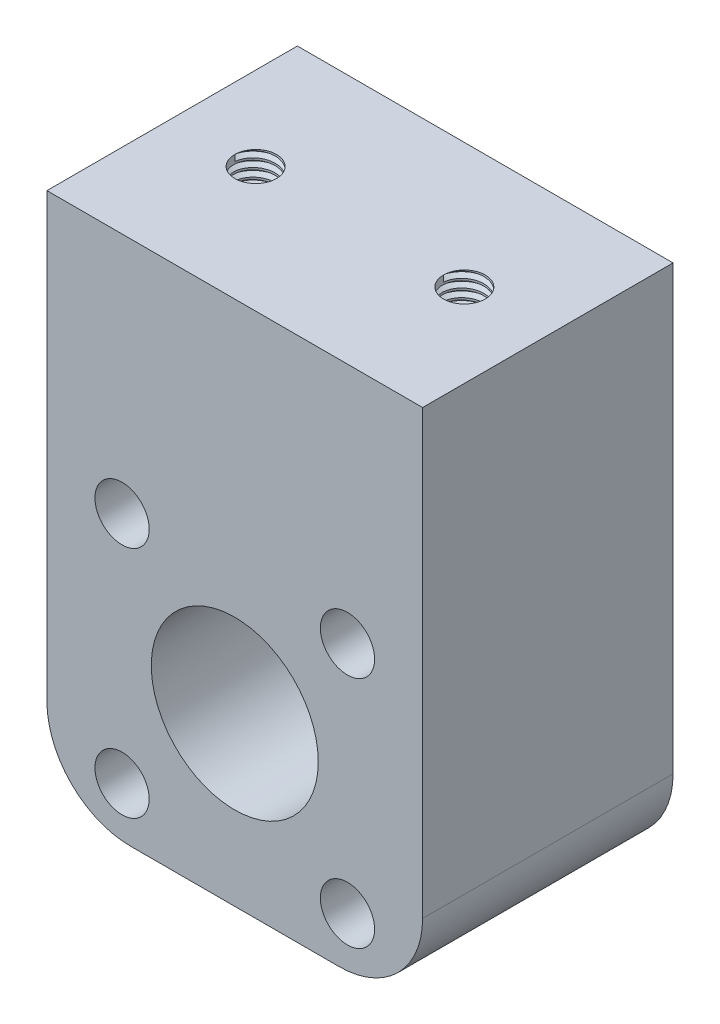
from build123d import *
from build123d.topology import SkipClean

# Parameters (mm, degrees)
SKETCH1_W           = 45
SKETCH1_H           = 63
BOSS_EXTRUDE1_DEPTH = 30
SKETCH2_R           = 10
CUT_EXTRUDE1_DEPTH  = 49.974483152
SKETCH3_R           = 3.25
CUT_EXTRUDE2_DEPTH  = 49.974483152
FILLET1_R           = 10
SKETCH4_R           = 2.5
CUT_EXTRUDE3_DEPTH  = 10
THREAD1_PITCH       = 1
THREAD2_PITCH       = 1


with BuildPart() as part:
    # Sketch1 → Boss-Extrude1 (new body)
    with BuildSketch(Plane.XY):
        Rectangle(SKETCH1_W, SKETCH1_H)
    extrude(amount=BOSS_EXTRUDE1_DEPTH)

    # Sketch2 → Cut-Extrude1 (cut, through all)
    with BuildSketch(Plane.XY.offset(30)):
        with Locations((0, -11.5)):
            Circle(SKETCH2_R)
    extrude(amount=-CUT_EXTRUDE1_DEPTH, mode=Mode.SUBTRACT)

    # Sketch3 → Cut-Extrude2 (cut, through all)
    with BuildSketch(Plane.XY.offset(30)):
        with Locations((-13.5, -25.5)):
            Circle(SKETCH3_R)
        with Locations((13.5, -25.5)):
            Circle(SKETCH3_R)
        with Locations((13.5, 2.5)):
            Circle(SKETCH3_R)
        with Locations((-13.5, 2.5)):
            Circle(SKETCH3_R)
    extrude(amount=-CUT_EXTRUDE2_DEPTH, mode=Mode.SUBTRACT)

    # Fillet1
    fillet1_edges = [part.edges().sort_by_distance(p)[0] for p in [
        (22.5, -31.5, 15),
        (-22.5, -31.5, 15),
    ]]
    fillet(fillet1_edges, radius=FILLET1_R)

    # Sketch4 → Cut-Extrude3 (cut)
    with BuildSketch(Plane(origin=(0, 31.5, 0), x_dir=(1, 0, 0), z_dir=(0, 1, 0))):
        with Locations(Location((-12.5, -15, 0), (0, 0, 270))):
            Circle(SKETCH4_R)
        with Locations(Location((12.5, -15, 0), (0, 0, 270))):
            Circle(SKETCH4_R)
    extrude(amount=-CUT_EXTRUDE3_DEPTH, mode=Mode.SUBTRACT)

    # Thread1: the profile of Thread Profile1 profile screwed along a right-hand helix of 10 turns, 8 arcs to a turn; built about Z, then put on its axis
    with SkipClean():  # the faces are left unmerged after this step: merging them gives an invalid solid
        thread1_z = Axis((0, 0, 0), (0, 0, 1))
        thread1_corners = [(2.4997, 0, -0.000173205), (3.041265875, 0, 0.312499999), (3.041265875, 0, 0.437499999), (2.4997, 0, 0.750173202)]
        with BuildLine(mode=Mode.PRIVATE) as thread1_profile:
            Line(thread1_corners[0], thread1_corners[1])
            Line(thread1_corners[1], thread1_corners[2])
            Line(thread1_corners[2], thread1_corners[3])
            Line(thread1_corners[3], thread1_corners[0])
        thread1_cap = Face(thread1_profile.wire())
        thread1_turn_angles = [0, 22.5, 45, 67.5, 90, 112.5, 135, 157.5, 180, 202.5, 225, 247.5, 270, 292.5, 315, 337.5, 360]
        thread1_turn_weights = [1, 0.9238795325112867, 1, 0.9238795325112867, 1, 0.9238795325112867, 1, 0.9238795325112867, 1, 0.9238795325112867, 1, 0.9238795325112867, 1, 0.9238795325112867, 1, 0.9238795325112867, 1]
        thread1_turn_rails = [Edge.make_bspline([Vector(p[0], p[1], 0).rotate(thread1_z, thread1_turn_angles[k]) / thread1_turn_weights[k] + Vector(0, 0, p[2] + THREAD1_PITCH * thread1_turn_angles[k] / 360) for k in range(17)], [0, 0, 0, 1, 1, 2, 2, 3, 3, 4, 4, 5, 5, 6, 6, 7, 7, 8, 8, 8], 2, thread1_turn_weights) for p in thread1_corners]
        thread1_turn_sides = [Face.make_surface_from_curves(thread1_turn_rails[p[0]], thread1_turn_rails[p[1]]) for p in [(0, 1), (1, 2), (2, 3), (3, 0)]]
        thread1 = Plane(origin=(12.5, 31.5, 15), x_dir=(-1, 0, 0), z_dir=(0, -1, 0)) * Solid(Shell([*[p.moved(Location((0, 0, THREAD1_PITCH * i))) for i in range(10) for p in thread1_turn_sides], thread1_cap, thread1_cap.rotate(thread1_z, 3600).moved(Location((0, 0, THREAD1_PITCH * 3600 / 360)))]))
        add(thread1, mode=Mode.SUBTRACT)

    # Thread2: the profile of Thread Profile2 profile screwed along a right-hand helix of 10 turns, 8 arcs to a turn; built about Z, then put on its axis
    with SkipClean():  # the faces are left unmerged after this step: merging them gives an invalid solid
        thread2_z = Axis((0, 0, 0), (0, 0, 1))
        thread2_corners = [(2.4997, 0, -0.000173205), (3.041265875, 0, 0.312499999), (3.041265875, 0, 0.437499999), (2.4997, 0, 0.750173202)]
        with BuildLine(mode=Mode.PRIVATE) as thread2_profile:
            Line(thread2_corners[0], thread2_corners[1])
            Line(thread2_corners[1], thread2_corners[2])
            Line(thread2_corners[2], thread2_corners[3])
            Line(thread2_corners[3], thread2_corners[0])
        thread2_cap = Face(thread2_profile.wire())
        thread2_turn_angles = [0, 22.5, 45, 67.5, 90, 112.5, 135, 157.5, 180, 202.5, 225, 247.5, 270, 292.5, 315, 337.5, 360]
        thread2_turn_weights = [1, 0.9238795325112867, 1, 0.9238795325112867, 1, 0.9238795325112867, 1, 0.9238795325112867, 1, 0.9238795325112867, 1, 0.9238795325112867, 1, 0.9238795325112867, 1, 0.9238795325112867, 1]
        thread2_turn_rails = [Edge.make_bspline([Vector(p[0], p[1], 0).rotate(thread2_z, thread2_turn_angles[k]) / thread2_turn_weights[k] + Vector(0, 0, p[2] + THREAD2_PITCH * thread2_turn_angles[k] / 360) for k in range(17)], [0, 0, 0, 1, 1, 2, 2, 3, 3, 4, 4, 5, 5, 6, 6, 7, 7, 8, 8, 8], 2, thread2_turn_weights) for p in thread2_corners]
        thread2_turn_sides = [Face.make_surface_from_curves(thread2_turn_rails[p[0]], thread2_turn_rails[p[1]]) for p in [(0, 1), (1, 2), (2, 3), (3, 0)]]
        thread2 = Plane(origin=(-12.5, 31.5, 15), x_dir=(-1, 0, 0), z_dir=(0, -1, 0)) * Solid(Shell([*[p.moved(Location((0, 0, THREAD2_PITCH * i))) for i in range(10) for p in thread2_turn_sides], thread2_cap, thread2_cap.rotate(thread2_z, 3600).moved(Location((0, 0, THREAD2_PITCH * 3600 / 360)))]))
        add(thread2, mode=Mode.SUBTRACT)


solid = part.part
